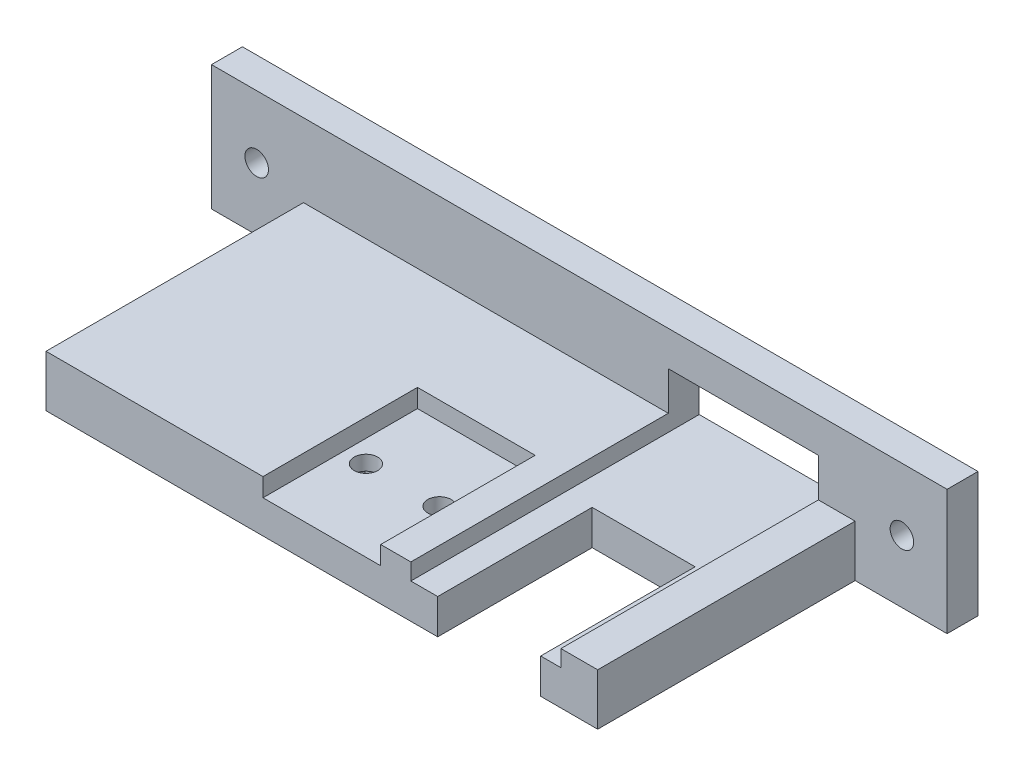
from build123d import *

# Parameters (mm, degrees)
BODY_DEPTH                = 7
SKETCH3_W                 = 16
SKETCH3_H                 = 21
CHIP_DIVET_DEPTH          = 2.5
SKETCH4_R                 = 1.6
CHIP_MOUNTING_HOLES_DEPTH = 58.827758025
CHIP_CAPTIVE_NUTS_DEPTH   = 2.5
SKETCH6_W                 = 14
SKETCH6_H                 = 21
SKETCH6_R                 = 7
ROUTING_HOLE_DEPTH        = 59.075809062
SKETCH7_W                 = 100
SKETCH7_H                 = 4.201909313
FACE_PLATE_DEPTH          = 10
SKETCH8_W                 = 20.4
SKETCH8_H                 = 7.5
SWITCH_HOLE_DEPTH         = 66.770735847
SKETCH2_R                 = 1.6
MOUNTING_HOLES_DEPTH      = 66.770735847


with BuildPart() as part:
    # Sketch1 → body (new body)
    with BuildSketch(Plane(origin=(0, 0, 0), x_dir=(1, 0, 0), z_dir=(0, 1, 0))):
        Polygon((-37.5, 6.298090687), (-37.5, -28.701909313), (37.5, -28.701909313), (37.5, 6.298090687), (50, 6.298090687), (50, 10.5), (-50, 10.5), (-50, 6.298090687), align=None)
    extrude(amount=BODY_DEPTH)

    # Sketch3 → chip-divet (cut)
    with BuildSketch(Plane(origin=(0, 7, 0), x_dir=(1, 0, 0), z_dir=(0, 1, 0))):
        with Locations((0, -18.201909313)):
            Rectangle(SKETCH3_W, SKETCH3_H)
    extrude(amount=-CHIP_DIVET_DEPTH, mode=Mode.SUBTRACT)

    # Sketch4 → chip-mounting-holes (cut, through all)
    with BuildSketch(Plane(origin=(0, 4.5, 0), x_dir=(1, 0, 0), z_dir=(0, 1, 0))):
        with Locations((-5, -17.701909313)):
            Circle(SKETCH4_R)
        with Locations((5, -17.701909313)):
            Circle(SKETCH4_R)
    extrude(amount=-CHIP_MOUNTING_HOLES_DEPTH, mode=Mode.SUBTRACT)

    # Sketch5 → chip-captive-nuts (cut)
    with BuildSketch(Plane.XZ):
        Polygon((5.744807806, 14.538404717), (8.112079249, 16.765179496), (7.367271442, 19.928684093), (4.255192194, 20.86541391), (1.887920751, 18.63863913), (2.632728558, 15.475134534), align=None)
        Polygon((-4.255192194, 14.538404717), (-1.887920751, 16.765179496), (-2.632728558, 19.928684093), (-5.744807806, 20.86541391), (-8.112079249, 18.63863913), (-7.367271442, 15.475134534), align=None)
    extrude(amount=-CHIP_CAPTIVE_NUTS_DEPTH, mode=Mode.SUBTRACT)

    # Sketch6 → routing-hole (cut, through all)
    with BuildSketch(Plane(origin=(0, 7, 0), x_dir=(1, 0, 0), z_dir=(0, 1, 0))):
        with Locations((22.75, -18.201909313)):
            Rectangle(SKETCH6_W, SKETCH6_H)
        with Locations((22.75, -18.201909313)):
            Circle(SKETCH6_R, mode=Mode.SUBTRACT)
    extrude(amount=-ROUTING_HOLE_DEPTH, mode=Mode.SUBTRACT)


with BuildPart() as routing_hole_kept_piece:
    # of the separate pieces the step leaves, the one the design keeps (routing_hole_pieces_kept)
    add(part.part.solids().sort_by_distance((37.5, 0, -6.298090687))[0])

    # Sketch7 → face-plate (add)
    with BuildSketch(Plane(origin=(0, 7, 0), x_dir=(1, 0, 0), z_dir=(0, 1, 0))):
        with Locations((0, 8.399045343)):
            Rectangle(SKETCH7_W, SKETCH7_H)
    extrude(amount=FACE_PLATE_DEPTH)

    # Sketch8 → switch-hole (cut, through all)
    with BuildSketch(Plane(origin=(0, 0, -10.5), x_dir=(-1, 0, 0), z_dir=(0, 0, -1))):
        with Locations((-22.3, 8.5)):
            Rectangle(SKETCH8_W, SKETCH8_H)
    extrude(amount=-SWITCH_HOLE_DEPTH, mode=Mode.SUBTRACT)

    # Sketch2 → mounting-holes (cut, through all)
    with BuildSketch(Plane(origin=(0, 0, -10.5), x_dir=(-1, 0, 0), z_dir=(0, 0, -1))):
        with Locations((-43.86, 8.5)):
            Circle(SKETCH2_R)
        with Locations((43.86, 8.5)):
            Circle(SKETCH2_R)
    extrude(amount=-MOUNTING_HOLES_DEPTH, mode=Mode.SUBTRACT)


solid = routing_hole_kept_piece.part
